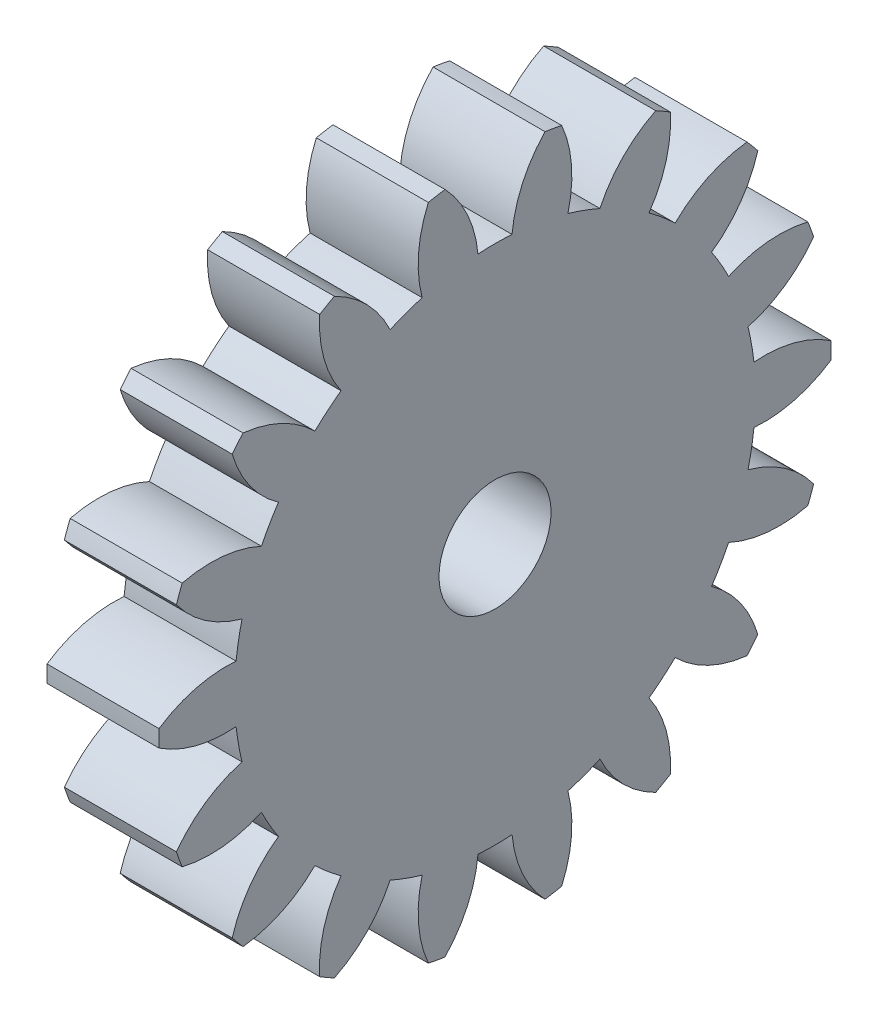
from build123d import *

# Parameters (mm, degrees)
BASPROSKE_W     = 5
BASPROSKE_H     = 15
TOOTHCUT_DEPTH  = 22.794494718
TEETHCUTS_COUNT = 18
TEETHCUTS_ANGLE = 340
BORSKE_R        = 2.5
BORE_DEPTH      = 50.0000508


with BuildPart() as part:
    # BasProSke → Base-Revolve (revolve)
    with BuildSketch(Plane(origin=(0, 0, 0), x_dir=(1, 0, 0), z_dir=(0, 1, 0))):
        with Locations((2.5, 7.5)):
            Rectangle(BASPROSKE_W, BASPROSKE_H)
    revolve(axis=Axis((-10, 0, 0), (1, 0, 0)))

    # TooCutSke → ToothCut (cut, through all)
    with BuildSketch(Plane(origin=(0, 0, 0), x_dir=(0, 0, -1), z_dir=(1, 0, 0))):
        with BuildLine():
            ThreePointArc((0.759974923, 11.599129886), (0, 11.624), (-0.759974923, 11.599129886))
            ThreePointArc((-0.759974923, 11.599129886), (-1.229186471, 13.354767823), (-2.254227748, 14.855339189))
            ThreePointArc((-2.254227748, 14.855339189), (0, 15.0254), (2.254227748, 14.855339189))
            ThreePointArc((2.254227748, 14.855339189), (1.229186471, 13.354767823), (0.759974923, 11.599129886))
        make_face()
    toothcut = extrude(amount=TOOTHCUT_DEPTH, mode=Mode.SUBTRACT)

    # TeethCuts: ToothCut ×18 about axis
    teethcuts_axis = Axis((-10, 0, 0), (1, 0, 0))
    for i in range(1, TEETHCUTS_COUNT):
        add(toothcut.rotate(teethcuts_axis, i * TEETHCUTS_ANGLE / (TEETHCUTS_COUNT - 1)), mode=Mode.SUBTRACT)

    # BorSke → Bore (cut, symmetric)
    with BuildSketch(Plane(origin=(0, 0, 0), x_dir=(0, 0, -1), z_dir=(1, 0, 0))):
        Circle(BORSKE_R)
    extrude(amount=BORE_DEPTH, both=True, mode=Mode.SUBTRACT)


solid = part.part
